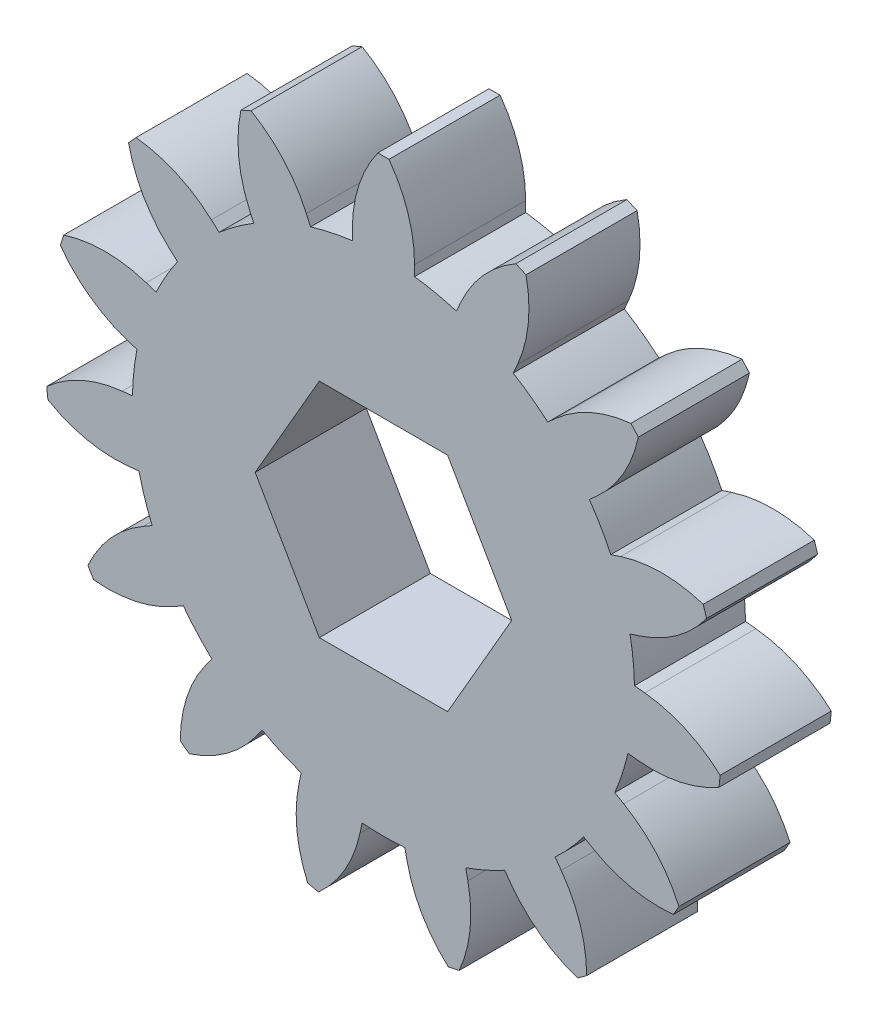
from build123d import *

# Parameters (mm, degrees)
SKETCH1_R           = 14.351
BOSS_EXTRUDE1_DEPTH = 6.35
BOSS_EXTRUDE2_DEPTH = 6.35
CIRPATTERN1_COUNT   = 15
FILLET2_R           = 7.62


with BuildPart() as part:
    # Sketch1 → Boss-Extrude1 (new body)
    with BuildSketch(Plane.XY):
        Circle(SKETCH1_R)
        Polygon((3.666174209, 6.35), (-3.666174209, 6.35), (-7.332348419, 0), (-3.666174209, -6.35), (3.666174209, -6.35), (7.332348419, 0), align=None, mode=Mode.SUBTRACT)
    extrude(amount=BOSS_EXTRUDE1_DEPTH)

    # Sketch2 → Boss-Extrude2 (add)
    with BuildSketch(Plane.XY.offset(6.35)):
        Polygon((-1.778, 14.240432472), (-1.778, 17.415432472), (-0.3175, 19.320432472), (0.3175, 19.320432472), (1.778, 17.415432472), (1.778, 14.240432472), align=None)
    boss_extrude2 = extrude(amount=-BOSS_EXTRUDE2_DEPTH)

    # CirPattern1: Boss-Extrude2 ×15 about axis
    cirpattern1_axis = Axis((0, 0, 0), (0, 0, 1))
    for i in range(1, CIRPATTERN1_COUNT):
        add(boss_extrude2.rotate(cirpattern1_axis, i * 360 / CIRPATTERN1_COUNT))

    # Fillet2
    # the kernel refuses this fillet: 7.62 mm, written as the material it takes off along each edge
    with BuildSketch(Plane(origin=(14.193206939, -10.247509404, 12.802712813), x_dir=(0.9914990413122959, 0.13011399262492193, 0), z_dir=(0, 0, -1)), Plane(origin=(17.112492753, 3.690686112, 12.802712813), x_dir=(0.566748814376109, 0.8238906367979154, 0), z_dir=(0, 0, -1)), Plane(origin=(8.798102154, -15.134463013, 12.802712813), x_dir=(0.9587015740252912, -0.2844139447379985, 0), z_dir=(0, 0, -1)), Plane(origin=(17.134177303, -3.588668323, 12.802712813), x_dir=(0.852857316870391, 0.5221440386144781, 0), z_dir=(0, 0, -1)), Plane(origin=(1.881725578, -17.404530475, 12.802712813), x_dir=(0.7601358950589386, -0.6497641272361426, 0), z_dir=(0, 0, -1)), Plane(origin=(-5.360018446, -16.665196502, 12.802712813), x_dir=(0.43013581421907954, -0.902764189213379, 0), z_dir=(0, 0, -1)), Plane(origin=(-17.505880519, -0.052148464, 12.802712813), x_dir=(-0.7256604883462944, -0.6880529453850317, 0), z_dir=(0, 0, -1)), Plane(origin=(-15.971206939, -7.167923068, 12.802712813), x_dir=(-0.38306749765514453, -0.9237203539168257, 0), z_dir=(0, 0, -1)), Plane(origin=(-11.674966586, -13.044298656, 12.802712813), x_dir=(0.025761343439545455, -0.9996681215204322, 0), z_dir=(0, 0, -1)), Plane(origin=(14.131902743, 10.331887391, 12.802712813), x_dir=(0.18264429312485506, 0.9831790590675343, 0), z_dir=(0, 0, -1)), Plane(origin=(-16.013628321, 7.072643084, 12.802712813), x_dir=(-0.9427801881837935, -0.3334149318313907, 0), z_dir=(0, 0, -1)), Plane(origin=(-11.752474307, 12.97451039, 12.802712813), x_dir=(-0.9968846285951874, 0.07887355241546373, 0), z_dir=(0, 0, -1)), Plane(origin=(1.778, 17.415432472, 12.802712813), x_dir=(-0.6084315436571516, 0.7936063612919037, 0), z_dir=(0, 0, -1))) as fillet2_piece_1:
        with BuildLine():
            CenterArc((2.587882788, -7.61769408), FILLET2_R, 91.409591302, 36.06658826)
            Line((-2.048365574, -1.570413607), (-2.141090542, -1.449467998))
            Line((-2.141090542, -1.449467998), (-0.092724967, 0.120945609))
            Line((-0.092724967, 0.120945609), (0, 0.1524))
            ThreePointArc((0, 0.1524), (1.200217194, 0.1524), (2.39668542, 0.152353882))
            Line((2.39668542, 0.152353882), (2.400434388, 0))
        make_face()
    extrude(amount=19.255425626, mode=Mode.SUBTRACT)
    with BuildSketch(Plane(origin=(-8.798102154, -15.134463013, 12.802712813), x_dir=(0.5877852522924732, 0.8090169943749473, 0), z_dir=(0, 0, -1)), Plane(origin=(-14.193206939, -10.247509404, 12.802712813), x_dir=(0.8660254037844384, 0.5000000000000004, 0), z_dir=(0, 0, -1)), Plane(origin=(-17.134177303, -3.588668323, 12.802712813), x_dir=(0.9945218953682733, 0.10452846326765367, 0), z_dir=(0, 0, -1)), Plane(origin=(-17.112492753, 3.690686112, 12.802712813), x_dir=(0.9510565162951536, -0.30901699437494723, 0), z_dir=(0, 0, -1)), Plane(origin=(-14.131902743, 10.331887391, 12.802712813), x_dir=(0.7431448254773942, -0.6691306063588581, 0), z_dir=(0, 0, -1)), Plane(origin=(-8.707778365, 15.186611477, 12.802712813), x_dir=(0.4067366430758003, -0.913545457642601, 0), z_dir=(0, 0, -1)), Plane(origin=(-1.881725578, -17.404530475, 12.802712813), x_dir=(0.20791169081775923, 0.9781476007338057, 0), z_dir=(0, 0, -1)), Plane(origin=(5.360018446, -16.665196502, 12.802712813), x_dir=(-0.20791169081775962, 0.9781476007338055, 0), z_dir=(0, 0, -1)), Plane(origin=(11.674966586, -13.044298656, 12.802712813), x_dir=(-0.587785252292474, 0.8090169943749468, 0), z_dir=(0, 0, -1)), Plane(origin=(15.971206939, -7.167923068, 12.802712813), x_dir=(-0.8660254037844383, 0.5000000000000009, 0), z_dir=(0, 0, -1)), Plane(origin=(5.459210718, 16.632966979, 12.802712813), x_dir=(-0.4067366430757998, -0.913545457642601, 0), z_dir=(0, 0, -1)), Plane(origin=(17.505880519, -0.052148464, 12.802712813), x_dir=(-0.9945218953682733, 0.10452846326765321, 0), z_dir=(0, 0, -1)), Plane(origin=(16.013628321, 7.072643084, 12.802712813), x_dir=(-0.9510565162951536, -0.3090169943749472, 0), z_dir=(0, 0, -1)), Plane(origin=(11.752474307, 12.97451039, 12.802712813), x_dir=(-0.7431448254773942, -0.6691306063588581, 0), z_dir=(0, 0, -1)), Plane(origin=(-1.778, 17.415432472, 12.802712813), x_dir=(0, -1, 0), z_dir=(0, 0, -1))) as fillet2_piece_2:
        with BuildLine():
            CenterArc((2.581085125, -7.62), FILLET2_R, 90, 36.06658826)
            Line((-1.905, -1.4605), (-1.994721703, -1.33731))
            ThreePointArc((-1.994721703, -1.33731), (-1.045224967, -0.609304391), (-0.092724967, 0.120945609))
            Line((-0.092724967, 0.120945609), (0, 0.1524))
            Line((0, 0.1524), (2.581085125, 0.1524))
            Line((2.581085125, 0.1524), (2.581085125, 0))
        make_face()
    extrude(amount=19.255425626, mode=Mode.SUBTRACT)
    with BuildSketch(Plane(origin=(8.707778365, 15.186611477, 12.802712813), x_dir=(-0.4067366430758002, -0.9135454576426009, 0), z_dir=(0, 0, -1)), Plane(origin=(-5.459210718, 16.632966979, 12.802712813), x_dir=(0.40673664307579993, -0.913545457642601, 0), z_dir=(0, 0, -1))) as fillet2_piece_3:
        with BuildLine():
            CenterArc((2.581085125, 7.62), FILLET2_R, 233.93341174, 36.06658826)
            Line((-1.905, 1.4605), (-1.994721703, 1.33731))
            ThreePointArc((-1.994721703, 1.33731), (-1.045224967, 0.609304391), (-0.092724967, -0.120945609))
            Line((-0.092724967, -0.120945609), (0, -0.1524))
            Line((0, -0.1524), (2.581085125, -0.1524))
            Line((2.581085125, -0.1524), (2.581085125, 0))
        make_face()
    extrude(amount=19.255425626, mode=Mode.SUBTRACT)


solid = part.part
